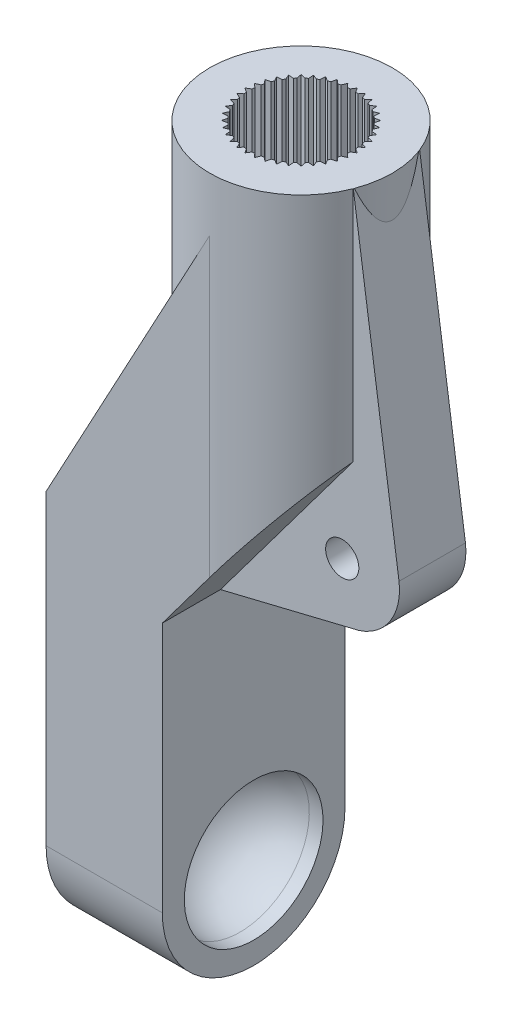
from build123d import *

# Parameters (mm, degrees)
BOSS_EXTRUDE4_DEPTH = 11
FILLET3_R           = 5.5
CUT_EXTRUDE3_REACH  = 50.052
CUT_EXTRUDE9_DEPTH  = 49.052435411
SKETCH13_R          = 1
BOSS_EXTRUDE8_DEPTH = 2
CUT_EXTRUDE13_DEPTH = 13
SKETCH16_R          = 4.175
CUT_EXTRUDE14_DEPTH = 5
FILLET5_R           = 4.175


with BuildPart() as part:
    # Sketch1 → Boss-Extrude4 (new body)
    with BuildSketch(Plane.XY):
        Polygon((-0.147048839, 37.772011135), (-0.147048839, 24.324355924), (-4.501, 16.248372033), (-4.501, -7.727988865), (2.498988475, -7.727988865), (2.49909512, 12.881113898), (10.852951161, 24.025114166), (10.852951161, 37.772011135), align=None)
    extrude(amount=BOSS_EXTRUDE4_DEPTH)

    # Fillet3
    fillet3_edges = [part.edges().sort_by_distance(p)[0] for p in [
        (-1.001005762, -7.727988865, 0),
        (-1.001005762, -7.727988865, 11),
    ]]
    fillet(fillet3_edges, radius=FILLET3_R - 0.0001)  # a hair under: the kernel refuses the full size

    # Cut-Extrude3: up to this plane
    cut_extrude3_end = Plane(origin=(-18.943259943, -10.540044817, 11), z_dir=(-0.8802278266520159, 0.4745513388322371, 0))
    # Sketch4 → Cut-Extrude3 (cut, up to the surface)
    with BuildSketch(Plane(origin=(0, 37.772011135, 0), x_dir=(1, 0, 0), z_dir=(0, 1, 0)), mode=Mode.PRIVATE) as cut_extrude3_sk1:
        with BuildLine():
            Line((5.352951161, 0), (-0.147048839, 0))
            Line((-0.147048839, 0), (-0.147048839, -5.5))
            ThreePointArc((-0.147048839, -5.5), (1.463863865, -1.610912703), (5.352951161, 0))
        make_face()
    cut_extrude3_tool1 = split(extrude(cut_extrude3_sk1.sketch, amount=-CUT_EXTRUDE3_REACH, mode=Mode.PRIVATE), bisect_by=cut_extrude3_end, keep=Keep.BOTH, mode=Mode.PRIVATE)
    add(cut_extrude3_tool1.solids().sort_by_distance((1.081475, 37.772011, 1.228524))[0], mode=Mode.SUBTRACT)
    # Sketch4 → Cut-Extrude3 (cut, up to the surface)
    with BuildSketch(Plane(origin=(0, 37.772011135, 0), x_dir=(1, 0, 0), z_dir=(0, 1, 0)), mode=Mode.PRIVATE) as cut_extrude3_sk2:
        with BuildLine():
            ThreePointArc((5.352951161, -11), (1.463863865, -9.389087297), (-0.147048839, -5.5))
            Line((-0.147048839, -5.5), (-0.147048839, -11))
            Line((-0.147048839, -11), (5.352951161, -11))
        make_face()
    cut_extrude3_tool2 = split(extrude(cut_extrude3_sk2.sketch, amount=-CUT_EXTRUDE3_REACH, mode=Mode.PRIVATE), bisect_by=cut_extrude3_end, keep=Keep.BOTH, mode=Mode.PRIVATE)
    add(cut_extrude3_tool2.solids().sort_by_distance((1.081475, 37.772011, 9.771476))[0], mode=Mode.SUBTRACT)

    # Sketch7 → Cut-Extrude9 (cut, through all)
    with BuildSketch(Plane(origin=(0, 37.772011135, 0), x_dir=(1, 0, 0), z_dir=(0, 1, 0))):
        with BuildLine():
            Line((10.852951161, -5.5), (10.852951161, 0))
            Line((10.852951161, 0), (5.352951161, 0))
            ThreePointArc((5.352951161, 0), (9.242038458, -1.610912703), (10.852951161, -5.5))
        make_face()
        with BuildLine():
            Line((10.852951161, -11), (10.852951161, -5.5))
            ThreePointArc((10.852951161, -5.5), (9.242038458, -9.389087297), (5.352951161, -11))
            Line((5.352951161, -11), (10.852951161, -11))
        make_face()
    extrude(amount=-CUT_EXTRUDE9_DEPTH, mode=Mode.SUBTRACT)

    # Sketch13 → Boss-Extrude8 (add, symmetric)
    with BuildSketch(Plane(origin=(0, 0, 5.5), x_dir=(-1, 0, 0), z_dir=(0, 0, -1))):
        with BuildLine():
            Line((-2.49909512, 12.881113898), (-10.852951161, 14.921371858))
            ThreePointArc((-10.852951161, 14.921371858), (-12.732065339, 16.372813465), (-13.252491897, 18.689472489))
            Line((-13.252491897, 18.689472489), (-10.500194932, 37.772011135))
            Line((-10.500194932, 37.772011135), (-5.352951161, 37.772011135))
            Line((-5.352951161, 37.772011135), (-2.49909512, 12.881113898))
        make_face()
        with Locations((-9.832418036, 18.165920669)):
            Circle(SKETCH13_R, mode=Mode.SUBTRACT)
    extrude(amount=BOSS_EXTRUDE8_DEPTH, both=True)

    # Sketch8 → Cut-Extrude13 (cut)
    with BuildSketch(Plane(origin=(0, 37.772011135, 0), x_dir=(1, 0, 0), z_dir=(0, 1, 0))):
        with BuildLine():
            Line((8.740856342, -5.5), (8.4736002, -5.335152867))
            ThreePointArc((8.4736002, -5.335152867), (8.468317829, -5.254815326), (8.460967605, -5.174640528))
            Line((8.460967605, -5.174640528), (8.699145608, -4.970014865))
            Line((8.699145608, -4.970014865), (8.416139719, -4.881533462))
            ThreePointArc((8.416139719, -4.881533462), (8.395441837, -4.786644907), (8.37180533, -4.692445354))
            Line((8.37180533, -4.692445354), (8.57504046, -4.453079724))
            Line((8.57504046, -4.453079724), (8.269924199, -4.378887473))
            ThreePointArc((8.269924199, -4.378887473), (8.2400747, -4.304114274), (8.208308847, -4.230134855))
            Line((8.208308847, -4.230134855), (8.371596781, -3.961923234))
            Line((8.371596781, -3.961923234), (8.058630782, -3.936375112))
            ThreePointArc((8.058630782, -3.936375112), (8.017451675, -3.867191985), (7.974503981, -3.79909265))
            Line((7.974503981, -3.79909265), (8.093824028, -3.508639298))
            Line((8.093824028, -3.508639298), (7.780714553, -3.532364385))
            ThreePointArc((7.780714553, -3.532364385), (7.729219804, -3.470474849), (7.676147784, -3.409932429))
            Line((7.676147784, -3.409932429), (7.748561889, -3.104389272))
            Line((7.748561889, -3.104389272), (7.443018732, -3.176803377))
            ThreePointArc((7.443018732, -3.176803377), (7.382476312, -3.123731357), (7.320586776, -3.072236608))
            Line((7.320586776, -3.072236608), (7.344311863, -2.759127133))
            Line((7.344311863, -2.759127133), (7.053858511, -2.87844718))
            ThreePointArc((7.053858511, -2.87844718), (6.985759176, -2.835499486), (6.916576049, -2.794320379))
            Line((6.916576049, -2.794320379), (6.891027927, -2.48135438))
            Line((6.891027927, -2.48135438), (6.622816307, -2.644642314))
            ThreePointArc((6.622816307, -2.644642314), (6.548836887, -2.612876461), (6.474063688, -2.583026962))
            Line((6.474063688, -2.583026962), (6.399871437, -2.277910701))
            Line((6.399871437, -2.277910701), (6.160505807, -2.481145831))
            ThreePointArc((6.160505807, -2.481145831), (6.082467923, -2.461343999), (6.003945815, -2.443559102))
            Line((6.003945815, -2.443559102), (5.882936296, -2.153805554))
            Line((5.882936296, -2.153805554), (5.678310633, -2.391983556))
            ThreePointArc((5.678310633, -2.391983556), (5.598135835, -2.384633332), (5.517798294, -2.379350961))
            Line((5.517798294, -2.379350961), (5.352951161, -2.112094819))
            Line((5.352951161, -2.112094819), (5.188104028, -2.379350961))
            ThreePointArc((5.188104028, -2.379350961), (5.107766487, -2.384633332), (5.02759169, -2.391983556))
            Line((5.02759169, -2.391983556), (4.822966027, -2.153805554))
            Line((4.822966027, -2.153805554), (4.701956507, -2.443559102))
            ThreePointArc((4.701956507, -2.443559102), (4.623434399, -2.461343999), (4.545396515, -2.481145831))
            Line((4.545396515, -2.481145831), (4.306030885, -2.277910701))
            Line((4.306030885, -2.277910701), (4.231838634, -2.583026962))
            ThreePointArc((4.231838634, -2.583026962), (4.157065435, -2.612876461), (4.083086016, -2.644642314))
            Line((4.083086016, -2.644642314), (3.814874395, -2.48135438))
            Line((3.814874395, -2.48135438), (3.789326273, -2.794320379))
            ThreePointArc((3.789326273, -2.794320379), (3.720143146, -2.835499486), (3.652043811, -2.87844718))
            Line((3.652043811, -2.87844718), (3.361590459, -2.759127133))
            Line((3.361590459, -2.759127133), (3.385315546, -3.072236608))
            ThreePointArc((3.385315546, -3.072236608), (3.32342601, -3.123731357), (3.26288359, -3.176803377))
            Line((3.26288359, -3.176803377), (2.957340434, -3.104389272))
            Line((2.957340434, -3.104389272), (3.029754538, -3.409932429))
            ThreePointArc((3.029754538, -3.409932429), (2.976682519, -3.470474849), (2.925187769, -3.532364385))
            Line((2.925187769, -3.532364385), (2.612078294, -3.508639298))
            Line((2.612078294, -3.508639298), (2.731398342, -3.79909265))
            ThreePointArc((2.731398342, -3.79909265), (2.688450648, -3.867191985), (2.64727154, -3.936375112))
            Line((2.64727154, -3.936375112), (2.334305541, -3.961923234))
            Line((2.334305541, -3.961923234), (2.497593476, -4.230134855))
            ThreePointArc((2.497593476, -4.230134855), (2.465827622, -4.304114274), (2.435978123, -4.378887473))
            Line((2.435978123, -4.378887473), (2.130861862, -4.453079724))
            Line((2.130861862, -4.453079724), (2.334096992, -4.692445354))
            ThreePointArc((2.334096992, -4.692445354), (2.31429516, -4.770483238), (2.296510264, -4.849005346))
            Line((2.296510264, -4.849005346), (2.006756715, -4.970014865))
            Line((2.006756715, -4.970014865), (2.244934717, -5.174640528))
            ThreePointArc((2.244934717, -5.174640528), (2.237584493, -5.254815326), (2.232302122, -5.335152867))
            Line((2.232302122, -5.335152867), (1.96504598, -5.5))
            Line((1.96504598, -5.5), (2.232302122, -5.664847133))
            ThreePointArc((2.232302122, -5.664847133), (2.237584493, -5.745184674), (2.244934717, -5.825359472))
            Line((2.244934717, -5.825359472), (2.006756715, -6.029985135))
            Line((2.006756715, -6.029985135), (2.296510264, -6.150994654))
            ThreePointArc((2.296510264, -6.150994654), (2.31429516, -6.229516762), (2.334096992, -6.307554646))
            Line((2.334096992, -6.307554646), (2.130861862, -6.546920276))
            Line((2.130861862, -6.546920276), (2.435978123, -6.621112527))
            ThreePointArc((2.435978123, -6.621112527), (2.465827622, -6.695885726), (2.497593476, -6.769865145))
            Line((2.497593476, -6.769865145), (2.334305541, -7.038076766))
            Line((2.334305541, -7.038076766), (2.64727154, -7.063624888))
            ThreePointArc((2.64727154, -7.063624888), (2.688450648, -7.132808015), (2.731398342, -7.20090735))
            Line((2.731398342, -7.20090735), (2.612078294, -7.491360702))
            Line((2.612078294, -7.491360702), (2.925187769, -7.467635615))
            ThreePointArc((2.925187769, -7.467635615), (2.976682519, -7.529525151), (3.029754538, -7.590067571))
            Line((3.029754538, -7.590067571), (2.957340434, -7.895610728))
            Line((2.957340434, -7.895610728), (3.26288359, -7.823196623))
            ThreePointArc((3.26288359, -7.823196623), (3.32342601, -7.876268643), (3.385315546, -7.927763392))
            Line((3.385315546, -7.927763392), (3.361590459, -8.240872867))
            Line((3.361590459, -8.240872867), (3.652043811, -8.12155282))
            ThreePointArc((3.652043811, -8.12155282), (3.720143146, -8.164500514), (3.789326273, -8.205679621))
            Line((3.789326273, -8.205679621), (3.814874395, -8.51864562))
            Line((3.814874395, -8.51864562), (4.083086016, -8.355357686))
            ThreePointArc((4.083086016, -8.355357686), (4.157065435, -8.387123539), (4.231838634, -8.416973038))
            Line((4.231838634, -8.416973038), (4.306030885, -8.722089299))
            Line((4.306030885, -8.722089299), (4.545396515, -8.518854169))
            ThreePointArc((4.545396515, -8.518854169), (4.623434399, -8.538656001), (4.701956507, -8.556440898))
            Line((4.701956507, -8.556440898), (4.822966027, -8.846194446))
            Line((4.822966027, -8.846194446), (5.02759169, -8.608016444))
            ThreePointArc((5.02759169, -8.608016444), (5.107766487, -8.615366668), (5.188104028, -8.620649039))
            Line((5.188104028, -8.620649039), (5.352951161, -8.887905181))
            Line((5.352951161, -8.887905181), (5.517798294, -8.620649039))
            ThreePointArc((5.517798294, -8.620649039), (5.598135835, -8.615366668), (5.678310633, -8.608016444))
            Line((5.678310633, -8.608016444), (5.882936296, -8.846194446))
            Line((5.882936296, -8.846194446), (6.003945815, -8.556440898))
            ThreePointArc((6.003945815, -8.556440898), (6.082467923, -8.538656001), (6.160505807, -8.518854169))
            Line((6.160505807, -8.518854169), (6.399871437, -8.722089299))
            Line((6.399871437, -8.722089299), (6.474063688, -8.416973038))
            ThreePointArc((6.474063688, -8.416973038), (6.548836887, -8.387123539), (6.622816307, -8.355357686))
            Line((6.622816307, -8.355357686), (6.891027927, -8.51864562))
            Line((6.891027927, -8.51864562), (6.916576049, -8.205679621))
            ThreePointArc((6.916576049, -8.205679621), (6.985759176, -8.164500514), (7.053858511, -8.12155282))
            Line((7.053858511, -8.12155282), (7.344311863, -8.240872867))
            Line((7.344311863, -8.240872867), (7.320586776, -7.927763392))
            ThreePointArc((7.320586776, -7.927763392), (7.382476312, -7.876268643), (7.443018732, -7.823196623))
            Line((7.443018732, -7.823196623), (7.748561889, -7.895610728))
            Line((7.748561889, -7.895610728), (7.676147784, -7.590067571))
            ThreePointArc((7.676147784, -7.590067571), (7.729219804, -7.529525151), (7.780714553, -7.467635615))
            Line((7.780714553, -7.467635615), (8.093824028, -7.491360702))
            Line((8.093824028, -7.491360702), (7.974503981, -7.20090735))
            ThreePointArc((7.974503981, -7.20090735), (8.017451675, -7.132808015), (8.058630782, -7.063624888))
            Line((8.058630782, -7.063624888), (8.371596781, -7.038076766))
            Line((8.371596781, -7.038076766), (8.208308847, -6.769865145))
            ThreePointArc((8.208308847, -6.769865145), (8.2400747, -6.695885726), (8.269924199, -6.621112527))
            Line((8.269924199, -6.621112527), (8.57504046, -6.546920276))
            Line((8.57504046, -6.546920276), (8.37180533, -6.307554646))
            ThreePointArc((8.37180533, -6.307554646), (8.391607162, -6.229516762), (8.409392059, -6.150994654))
            Line((8.409392059, -6.150994654), (8.699145608, -6.029985135))
            Line((8.699145608, -6.029985135), (8.460967605, -5.825359472))
            ThreePointArc((8.460967605, -5.825359472), (8.468317829, -5.745184674), (8.4736002, -5.664847133))
            Line((8.4736002, -5.664847133), (8.740856342, -5.5))
        make_face()
    extrude(amount=-CUT_EXTRUDE13_DEPTH, mode=Mode.SUBTRACT)

    # Sketch16 → Cut-Extrude14 (cut)
    with BuildSketch(Plane(origin=(2.499028465, -1.2932e-05, 0), x_dir=(0, 0, -1), z_dir=(0.9999999999866115, -5.17464205651243e-06, 0))):
        with Locations(Location((-5.5, -2.227975933, 0), (0, 0, 90))):
            Circle(SKETCH16_R)
    extrude(amount=-CUT_EXTRUDE14_DEPTH, mode=Mode.SUBTRACT)

    # Fillet5
    fillet5_edges = [part.edges().sort_by_distance(p)[0] for p in [
        (-2.501004668, -6.402962991, 5.5),
    ]]
    fillet(fillet5_edges, radius=FILLET5_R)


solid = part.part
